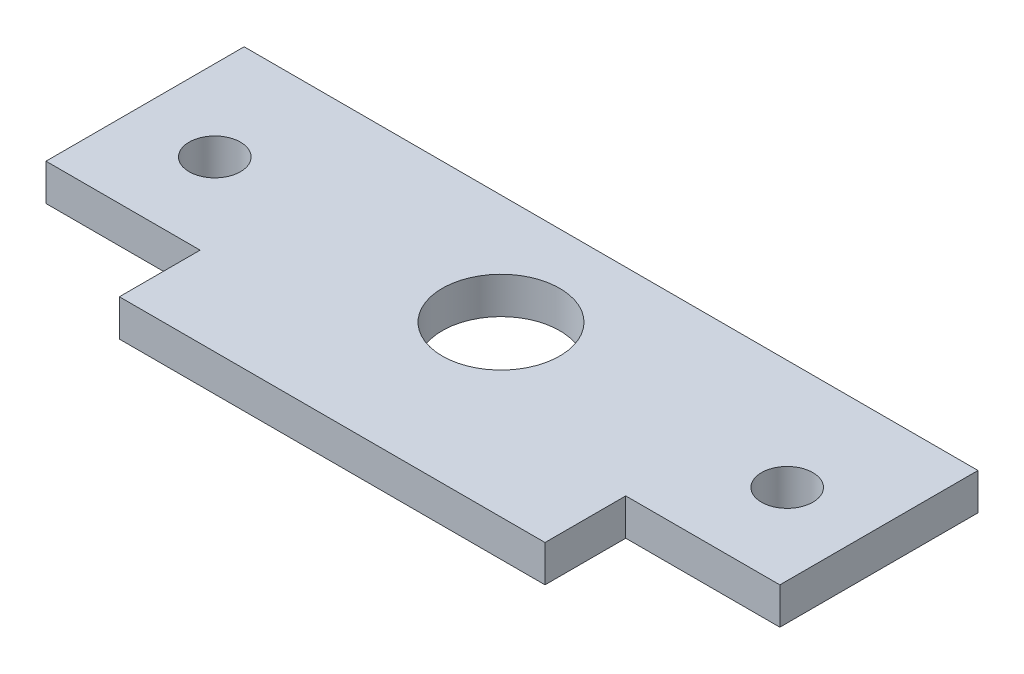
from build123d import *

# Parameters (mm, degrees)
SKETCH_1_W          = 100
SKETCH_1_H          = 38
SKETCH_1_R          = 8
SKETCH_1_R_2        = 3.5
EXTRUDE_1_DEPTH     = 5
CUT_EXTRUDE_1_REACH = 57.263
SKETCH_2_W          = 21
SKETCH_2_H          = 11


with BuildPart() as part:
    # 草图1 → 凸台-拉伸1 (new body)
    with BuildSketch(Plane(origin=(0, 0, 0), x_dir=(1, 0, 0), z_dir=(0, 1, 0))):
        with Locations((0, -4)):
            Rectangle(SKETCH_1_W, SKETCH_1_H)
        Circle(SKETCH_1_R, mode=Mode.SUBTRACT)
        with Locations((39, 0)):
            Circle(SKETCH_1_R_2, mode=Mode.SUBTRACT)
        with Locations((-39, 0)):
            Circle(SKETCH_1_R_2, mode=Mode.SUBTRACT)
    extrude(amount=EXTRUDE_1_DEPTH)

    # 草图2 → 切除-拉伸1 (cut, up to next)
    with BuildSketch(Plane(origin=(0, 5, 0), x_dir=(1, 0, 0), z_dir=(0, 1, 0)), mode=Mode.PRIVATE) as cut_extrude_1_sk1:
        with Locations((39.5, -17.5)):
            Rectangle(SKETCH_2_W, SKETCH_2_H)
    cut_extrude_1_tool1 = extrude(cut_extrude_1_sk1.sketch, amount=-CUT_EXTRUDE_1_REACH, mode=Mode.PRIVATE) & part.part
    # 草图2 → 切除-拉伸1 (cut, up to next)
    with BuildSketch(Plane(origin=(0, 5, 0), x_dir=(1, 0, 0), z_dir=(0, 1, 0)), mode=Mode.PRIVATE) as cut_extrude_1_sk2:
        with Locations((-39.5, -17.5)):
            Rectangle(SKETCH_2_W, SKETCH_2_H)
    cut_extrude_1_tool2 = extrude(cut_extrude_1_sk2.sketch, amount=-CUT_EXTRUDE_1_REACH, mode=Mode.PRIVATE) & part.part
    add(cut_extrude_1_tool1.solids().sort_by_distance((39.5, 5, 17.5))[0], mode=Mode.SUBTRACT)
    add(cut_extrude_1_tool2.solids().sort_by_distance((-39.5, 5, 17.5))[0], mode=Mode.SUBTRACT)


solid = part.part
